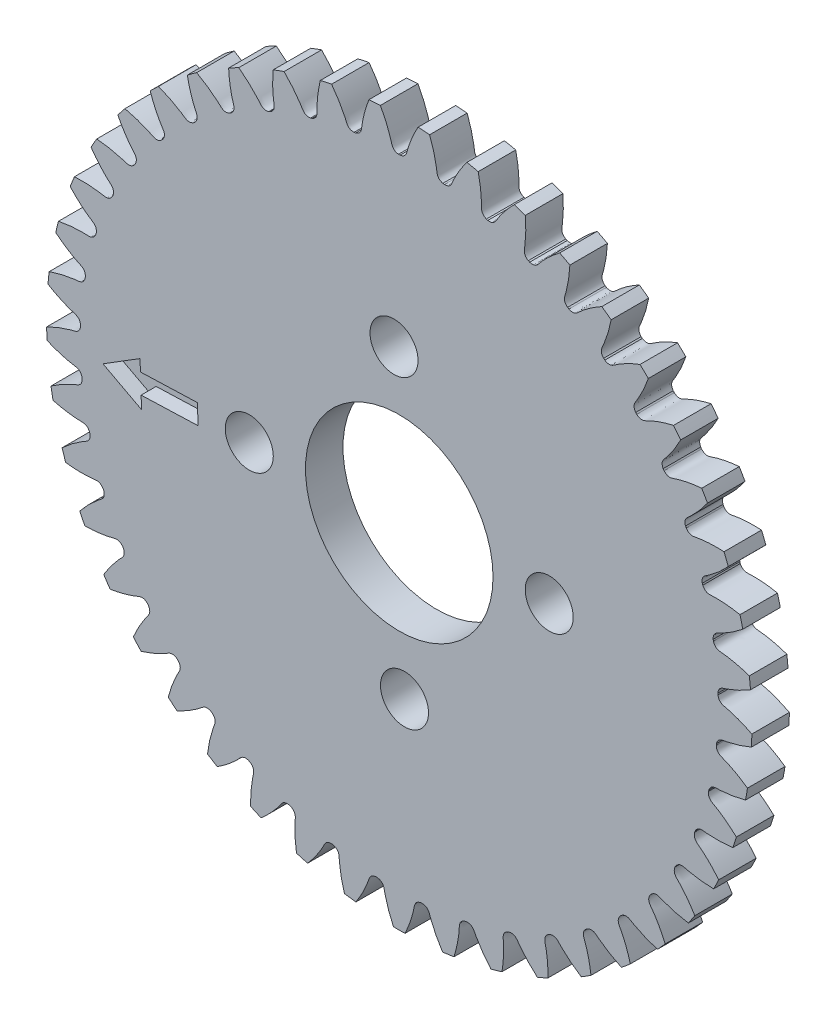
from build123d import *

# Parameters (mm, degrees)
SKETCH_1_R               = 23.5
EXTRUDE_1_DEPTH          = 2.5
CUT_EXTRUDE_1_DEPTH      = 34.327916226
PATTERN_CIRCULAR_1_COUNT = 45
SKETCH_4_R               = 6.25
CUT_EXTRUDE_2_DEPTH      = 10
SKETCH_5_R               = 1.6
CUT_EXTRUDE_3_DEPTH      = 10
CUT_EXTRUDE_4_DEPTH      = 1


with BuildPart() as part:
    # 草图1 → 凸台-拉伸1 (new body)
    with BuildSketch(Plane.XY):
        Circle(SKETCH_1_R)
    extrude(amount=EXTRUDE_1_DEPTH)

    # 草图2 → 切除-拉伸1 (cut, through all)
    with BuildSketch(Plane.XY):
        with BuildLine():
            ThreePointArc((0.051873264, 21.249936686), (0, 21.25), (-0.051873264, 21.249936686))
            add(Edge.make_bspline(
                [(-0.051873264, 21.249936686), (-0.443572136, 21.304099562), (-0.488057885, 21.594745963), (-0.580625684, 21.909595528), (-0.616187717, 22.023701477), (-0.656820366, 22.145031226), (-0.702678597, 22.273509106), (-0.754106978, 22.408946374), (-0.811388198, 22.551175843), (-0.874816981, 22.700012294), (-0.944678084, 22.855264244), (-1.021252408, 23.016730684), (-1.104814919, 23.184202197), (-1.195634949, 23.357460817), (-1.293975814, 23.536280256), (-1.400094629, 23.720426036), (-1.514242081, 23.909655655), (-1.636662209, 24.103718747), (-1.767592191, 24.302357255), (-1.907262137, 24.505305605), (-2.055894882, 24.712290888), (-2.213705786, 24.923033045), (-2.380902537, 25.137245056), (-2.557684962, 25.354633139), (-2.744244834, 25.574896952), (-2.940765714, 25.79772979), (-3.147422686, 26.022818809), (-3.44059804, 26.329597021), (-3.670417998, 26.555895846), (-3.828553255, 26.70565732)],
                knots=[0, 0, 0, 0, 0.112268392, 0.128789174, 0.146568276, 0.165605699, 0.185901442, 0.207455506, 0.23026789, 0.254338595, 0.27966762, 0.306254966, 0.334100632, 0.363204619, 0.393566926, 0.425187554, 0.458066503, 0.492203772, 0.527599361, 0.564253271, 0.602165502, 0.641336053, 0.681764924, 0.723452116, 0.766397629, 0.810601462, 0.856063616, 0.90278409, 1, 1, 1, 1], degree=3))
            ThreePointArc((-3.828553255, 26.70565732), (0, 26.978694426), (3.828553255, 26.70565732))
            add(Edge.make_bspline(
                [(0.051873264, 21.249936686), (0.443572136, 21.304099562), (0.488057885, 21.594745963), (0.580625684, 21.909595528), (0.616187717, 22.023701477), (0.656820366, 22.145031226), (0.702678597, 22.273509106), (0.754106978, 22.408946374), (0.811388198, 22.551175843), (0.874816981, 22.700012294), (0.944678084, 22.855264244), (1.021252408, 23.016730684), (1.104814919, 23.184202197), (1.195634949, 23.357460817), (1.293975814, 23.536280256), (1.400094629, 23.720426036), (1.514242081, 23.909655655), (1.636662209, 24.103718747), (1.767592191, 24.302357255), (1.907262137, 24.505305605), (2.055894882, 24.712290888), (2.213705786, 24.923033045), (2.380902537, 25.137245056), (2.557684962, 25.354633139), (2.744244834, 25.574896952), (2.940765714, 25.79772979), (3.147422686, 26.022818809), (3.44059804, 26.329597021), (3.670417998, 26.555895846), (3.828553255, 26.70565732)],
                knots=[0, 0, 0, 0, 0.112268392, 0.128789174, 0.146568276, 0.165605699, 0.185901442, 0.207455506, 0.23026789, 0.254338595, 0.27966762, 0.306254966, 0.334100632, 0.363204619, 0.393566926, 0.425187554, 0.458066503, 0.492203772, 0.527599361, 0.564253271, 0.602165502, 0.641336053, 0.681764924, 0.723452116, 0.766397629, 0.810601462, 0.856063616, 0.90278409, 1, 1, 1, 1], degree=3))
        make_face()
    cut_extrude_1 = extrude(amount=CUT_EXTRUDE_1_DEPTH, mode=Mode.SUBTRACT)

    # 阵列(圆周)1: 切除-拉伸1 ×45 about axis
    pattern_circular_1_axis = Axis((0, 0, 2.5), (0, 0, -1))
    for i in range(1, PATTERN_CIRCULAR_1_COUNT):
        add(cut_extrude_1.rotate(pattern_circular_1_axis, i * 360 / PATTERN_CIRCULAR_1_COUNT), mode=Mode.SUBTRACT)

    # 草图4 → 切除-拉伸2 (cut)
    with BuildSketch(Plane.XY.offset(2.5)):
        Circle(SKETCH_4_R)
    extrude(amount=-CUT_EXTRUDE_2_DEPTH, mode=Mode.SUBTRACT)

    # 草图5 → 切除-拉伸3 (cut)
    with BuildSketch(Plane.XY.offset(2.5)):
        with Locations((-9.99390827, -0.348994967)):
            Circle(SKETCH_5_R)
        with Locations((-0.348994967, 9.99390827)):
            Circle(SKETCH_5_R)
        with Locations((9.99390827, 0.348994967)):
            Circle(SKETCH_5_R)
        with Locations((0.348994967, -9.99390827)):
            Circle(SKETCH_5_R)
    extrude(amount=-CUT_EXTRUDE_3_DEPTH, mode=Mode.SUBTRACT)

    # 草图7 → 切除-拉伸4 (cut)
    with BuildSketch(Plane.XY.offset(2.5)):
        Polygon((-19.743883951, -0.68947162), (-17.273619723, 0.846892445), (-17.247026301, 0.085356498), (-13.450910098, 0.217919797), (-13.405127564, -1.093120448), (-17.201243767, -1.225683747), (-17.172465823, -2.049776259), align=None)
    extrude(amount=-CUT_EXTRUDE_4_DEPTH, mode=Mode.SUBTRACT)


solid = part.part
